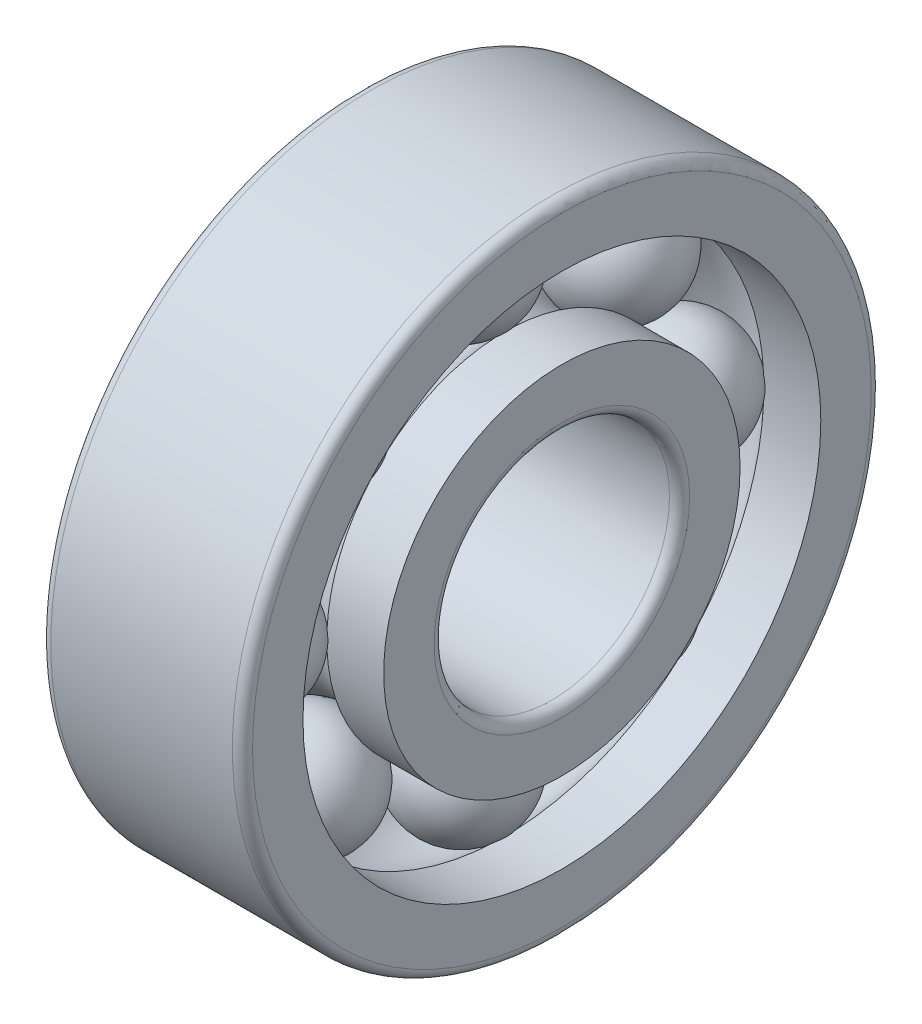
from build123d import *

# Parameters (mm, degrees)
CAGSPISKE_W         = 0.36
CAGSPISKE_H         = 0.6
CAGESPINE_ANGLE     = 0.001
BALLSDETAILED_COUNT = 8
BALLSDETAILED_ANGLE = 315


with BuildPart() as part:
    # CagSpiSke → CageSpine (revolve)
    with BuildSketch(Plane.XY):
        with Locations((0, 6.5)):
            Rectangle(CAGSPISKE_W, CAGSPISKE_H)
    revolve(axis=Axis((-20.6375, 0, 0), (-1, 0, 0)), revolution_arc=CAGESPINE_ANGLE)

    # BalDetSke → BallDetailed (revolve)
    with BuildSketch(Plane.XY):
        with BuildLine():
            Line((-1.8, 6.5), (1.8, 6.5))
            ThreePointArc((1.8, 6.5), (0, 4.7), (-1.8, 6.5))
        make_face()
    balldetailed = revolve(axis=Axis((-1.905, 6.5, 0), (1, 0, 0)))

    # InnRacSke → InnerRace (revolve)
    with BuildSketch(Plane.XY):
        with BuildLine():
            Line((-1.307908636, 5.3), (-3, 5.3))
            Line((-3, 5.3), (-3, 3.8))
            ThreePointArc((-3, 3.8), (-2.912132034, 3.587867966), (-2.7, 3.5))
            Line((-2.7, 3.5), (2.7, 3.5))
            ThreePointArc((2.7, 3.5), (2.912132034, 3.587867966), (3, 3.8))
            Line((3, 3.8), (3, 5.3))
            Line((3, 5.3), (1.307908636, 5.3))
            ThreePointArc((1.307908636, 5.3), (0, 4.725), (-1.307908636, 5.3))
        make_face()
    revolve(axis=Axis((-20.6375, 0, 0), (1, 0, 0)))

    # OutRacSke → OuterRace (revolve)
    with BuildSketch(Plane.XY):
        with BuildLine():
            Line((-1.307908636, 7.7), (-3, 7.7))
            Line((-3, 7.7), (-3, 9.2))
            ThreePointArc((-3, 9.2), (-2.912132034, 9.412132034), (-2.7, 9.5))
            Line((-2.7, 9.5), (2.7, 9.5))
            ThreePointArc((2.7, 9.5), (2.912132034, 9.412132034), (3, 9.2))
            Line((3, 9.2), (3, 7.7))
            Line((3, 7.7), (1.307908636, 7.7))
            ThreePointArc((1.307908636, 7.7), (0, 8.275), (-1.307908636, 7.7))
        make_face()
    revolve(axis=Axis((-20.6375, 0, 0), (1, 0, 0)))

    # BallsDetailed: BallDetailed ×8 about axis
    ballsdetailed_axis = Axis((-50, 0, 0), (1, 0, 0))
    for i in range(1, BALLSDETAILED_COUNT):
        add(balldetailed.rotate(ballsdetailed_axis, i * BALLSDETAILED_ANGLE / (BALLSDETAILED_COUNT - 1)))


solid = part.part
